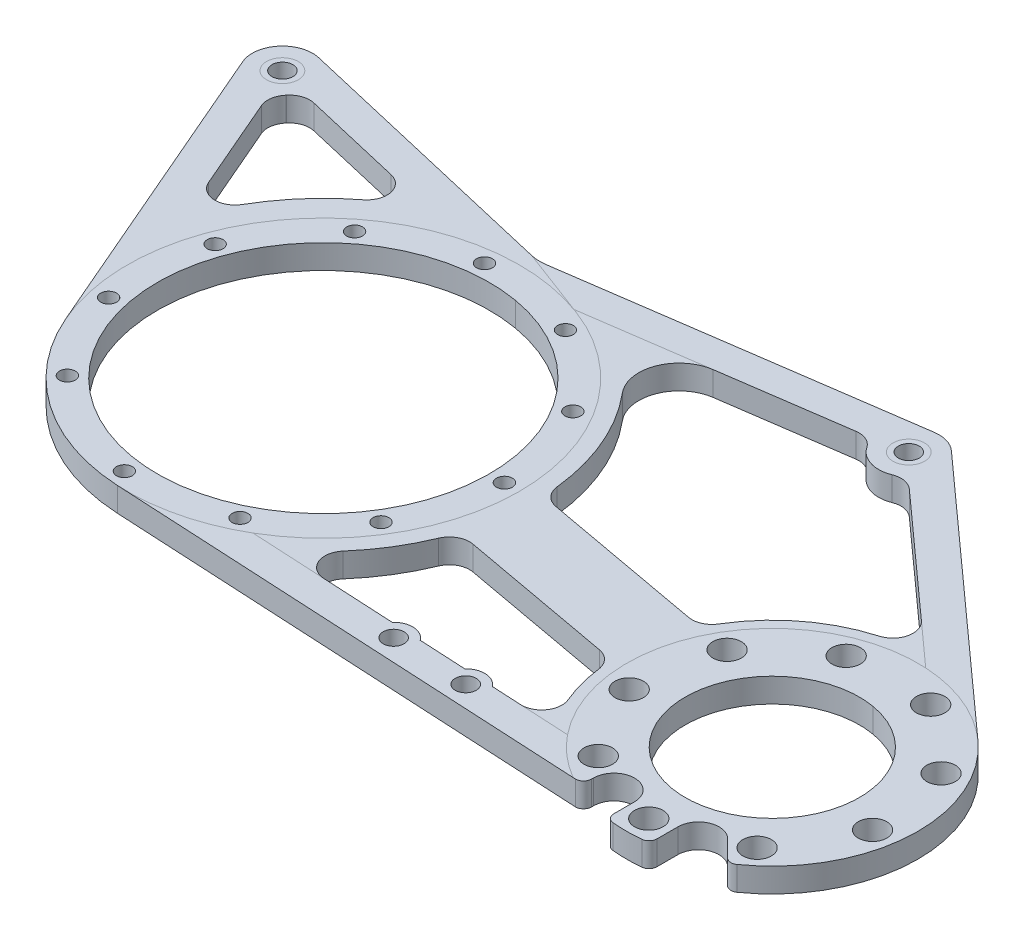
from build123d import *

# Parameters (mm, degrees)
SKETCH2_R             = 2.5
SKETCH2_R_2           = 4.5
SKETCH2_R_3           = 27.4955
SKETCH2_R_4           = 3.3
BOSS_EXTRUDE1_DEPTH   = 7.62
CUT_EXTRUDE1_DEPTH    = 977.654400972
FILLET2_R             = 12.7
CUT_EXTRUDE2_DEPTH    = 977.654400972
CIRPATTERN2_START     = 31.381947118
CIRPATTERN2_OUTLINE_R = 2.5
CIRPATTERN2_DEPTH     = 7.62
FILLET4_R             = 6.3754
CUT_EXTRUDE4_DEPTH    = 977.654400972
FILLET5_R             = 6.3754
FILLET6_R             = 6.3754
FILLET7_R             = 12.7
SKETCH11_R            = 3.3
CUT_EXTRUDE5_DEPTH    = 977.654400972
BOSS_EXTRUDE2_DEPTH   = 7.62


# Read off the part's stored shape, not the designer's step: CirPattern2
with BuildPart() as part:
    # Sketch2 → Boss-Extrude1 (new body)
    # profile 1 of 10: a face of its own
    with BuildSketch(Plane(origin=(0, 31.381947118, 0), x_dir=(1, 0, 0), z_dir=(0, 1, 0))):
        with BuildLine():
            ThreePointArc((-913.231203194, -139.306107665), (-891.842137326, -162.294673087), (-861.92593364, -171.83338557))
            ThreePointArc((-861.92593364, -171.83338557), (-820.11475592, -158.430942405), (-797.704649202, -120.673993615))
            ThreePointArc((-797.704649202, -120.673993615), (-797.01050218, -115.359784371), (-796.77854046, -110.005453999))
            ThreePointArc((-796.77854046, -110.005453999), (-871.210429691, -49.371943878), (-915.540423748, -134.526980787))
            ThreePointArc((-915.540423748, -134.526980787), (-914.437051565, -136.941301899), (-913.231203194, -139.306107665))
        make_face()
        with Locations((-864.664842136, -166.842380319)):
            Circle(SKETCH2_R, mode=Mode.SUBTRACT)
        with BuildLine():
            ThreePointArc((-806.30354046, -110.005453999), (-806.499815761, -114.536041237), (-807.087170934, -119.032679828))
            ThreePointArc((-807.087170934, -119.032679828), (-910.882265158, -105.474866761), (-806.30354046, -110.005453999))
        make_face(mode=Mode.SUBTRACT)
    # profile 2 of 10: a face of its own
    with BuildSketch(Plane(origin=(0, 31.381947118, 0), x_dir=(1, 0, 0), z_dir=(0, 1, 0))):
        with BuildLine():
            ThreePointArc((-663.719686073, -177.370678379), (-662.142049476, -178.105218992), (-660.461885462, -177.651858179))
            ThreePointArc((-660.461885462, -177.651858179), (-688.572459971, -94.109699917), (-710.607035859, -179.455901191))
            ThreePointArc((-710.607035859, -179.455901191), (-708.047835111, -179.48984757), (-706.758334948, -177.278999281))
            Line((-706.758334948, -177.278999281), (-706.758334948, -176.701988839))
            ThreePointArc((-706.758334948, -176.701988839), (-700.258334948, -170.201988839), (-693.758334948, -176.701988839))
            Line((-693.758334948, -176.701988839), (-693.758334948, -183.274721629))
            ThreePointArc((-693.758334948, -183.274721629), (-693.101169654, -184.979577479), (-691.469725918, -185.802250576))
            ThreePointArc((-691.469725918, -185.802250576), (-686.919549358, -186.027976628), (-682.369372798, -185.802250576))
            ThreePointArc((-682.369372798, -185.802250576), (-680.737929062, -184.979577479), (-680.080763768, -183.274721629))
            Line((-680.080763768, -183.274721629), (-680.080763768, -176.701988839))
            ThreePointArc((-680.080763768, -176.701988839), (-676.068206079, -170.696771877), (-668.984569691, -172.105794761))
            Line((-668.984569691, -172.105794761), (-663.719686073, -177.370678379))
        make_face()
        with Locations((-686.919549358, -179.053976628)):
            Circle(SKETCH2_R_2, mode=Mode.SUBTRACT)
        with Locations((-661.85083258, -169.92970991)):
            Circle(SKETCH2_R_2, mode=Mode.SUBTRACT)
        with Locations((-648.51204699, -146.826255557)):
            Circle(SKETCH2_R_2, mode=Mode.SUBTRACT)
        with Locations((-653.14455861, -120.553976628)):
            Circle(SKETCH2_R_2, mode=Mode.SUBTRACT)
        with Locations((-673.580763768, -103.405964417)):
            Circle(SKETCH2_R_2, mode=Mode.SUBTRACT)
        with Locations((-700.258334948, -103.405964417)):
            Circle(SKETCH2_R_2, mode=Mode.SUBTRACT)
        with Locations((-720.694540106, -120.553976628)):
            Circle(SKETCH2_R_2, mode=Mode.SUBTRACT)
        with Locations((-725.327051725, -146.826255557)):
            Circle(SKETCH2_R_2, mode=Mode.SUBTRACT)
        with Locations((-711.988266136, -169.92970991)):
            Circle(SKETCH2_R_2, mode=Mode.SUBTRACT)
        with Locations((-686.919549358, -140.053976628)):
            Circle(SKETCH2_R_3, mode=Mode.SUBTRACT)
    # profile 3 of 10: a face of its own
    with BuildSketch(Plane(origin=(0, 31.381947118, 0), x_dir=(1, 0, 0), z_dir=(0, 1, 0))):
        with BuildLine():
            Line((-861.92593364, -171.83338557), (-709.563399524, -179.805130863))
            ThreePointArc((-709.563399524, -179.805130863), (-710.104359013, -179.687717863), (-710.607035859, -179.455901191))
            ThreePointArc((-710.607035859, -179.455901191), (-728.743420505, -159.142519743), (-732.205854251, -132.131902082))
            Line((-732.205854251, -132.131902082), (-797.704649202, -120.673993615))
            ThreePointArc((-797.704649202, -120.673993615), (-820.11475592, -158.430942405), (-861.92593364, -171.83338557))
        make_face()
    # profile 4 of 10: a face of its own
    with BuildSketch(Plane(origin=(0, 31.381947118, 0), x_dir=(1, 0, 0), z_dir=(0, 1, 0))):
        with BuildLine():
            ThreePointArc((-796.77854046, -110.005453999), (-797.01050218, -115.359784371), (-797.704649202, -120.673993615))
            Line((-797.704649202, -120.673993615), (-732.205854251, -132.131902082))
            ThreePointArc((-732.205854251, -132.131902082), (-701.928176702, -96.598829853), (-656.175138478, -105.872258186))
            Line((-656.175138478, -105.872258186), (-734.471346389, -35.449503096))
            Line((-734.471346389, -35.449503096), (-737.45167366, -41.840835553))
            ThreePointArc((-737.45167366, -41.840835553), (-749.026894919, -46.874452701), (-755.434553976, -35.999483543))
            Line((-755.434553976, -35.999483543), (-753.896931719, -28.08212915))
            Line((-753.896931719, -28.08212915), (-944.165914661, -23.010008435))
            Line((-944.165914661, -23.010008435), (-941.416205936, -26.93699947))
            ThreePointArc((-941.416205936, -26.93699947), (-940.134475202, -29.536092286), (-939.693629158, -32.400315026))
            ThreePointArc((-939.693629158, -32.400315026), (-945.26796105, -41.067370264), (-955.466405327, -39.589954651))
            Line((-955.466405327, -39.589954651), (-957.104925163, -38.166085623))
            Line((-957.104925163, -38.166085623), (-915.540423748, -134.526980787))
            ThreePointArc((-915.540423748, -134.526980787), (-871.210429691, -49.371943878), (-796.77854046, -110.005453999))
        make_face()
    # profile 5 of 10: a face of its own
    with BuildSketch(Plane(origin=(0, 31.381947118, 0), x_dir=(1, 0, 0), z_dir=(0, 1, 0))):
        with BuildLine():
            ThreePointArc((-755.434553976, -35.999483543), (-749.026894919, -46.874452701), (-737.45167366, -41.840835553))
            ThreePointArc((-737.45167366, -41.840835553), (-736.785035864, -39.876983933), (-736.559255332, -37.81539661))
            ThreePointArc((-736.559255332, -37.81539661), (-737.383766778, -33.938913161), (-739.714556945, -30.733548866))
            ThreePointArc((-739.714556945, -30.733548866), (-742.67316861, -28.92213442), (-746.084255332, -28.29039661))
            ThreePointArc((-746.084255332, -28.29039661), (-752.143506648, -30.466172264), (-755.434553976, -35.999483543))
        make_face()
        with BuildLine():
            ThreePointArc((-742.844781786, -38.444531846), (-746.713390568, -41.054870156), (-749.323728878, -37.186261374))
            ThreePointArc((-749.323728878, -37.186261374), (-745.455120096, -34.575923064), (-742.844781786, -38.444531846))
        make_face(mode=Mode.SUBTRACT)
    # profile 6 of 10: a face of its own
    with BuildSketch(Plane(origin=(0, 31.381947118, 0), x_dir=(1, 0, 0), z_dir=(0, 1, 0))):
        with BuildLine():
            Line((-753.896931719, -28.08212915), (-755.434553976, -35.999483543))
            ThreePointArc((-755.434553976, -35.999483543), (-752.143506648, -30.466172264), (-746.084255332, -28.29039661))
            Line((-746.084255332, -28.29039661), (-753.896931719, -28.08212915))
        make_face()
    # profile 7 of 10: a face of its own
    with BuildSketch(Plane(origin=(0, 31.381947118, 0), x_dir=(1, 0, 0), z_dir=(0, 1, 0))):
        with BuildLine():
            Line((-737.45167366, -41.840835553), (-734.471346389, -35.449503096))
            Line((-734.471346389, -35.449503096), (-739.714556945, -30.733548866))
            ThreePointArc((-739.714556945, -30.733548866), (-737.383766778, -33.938913161), (-736.559255332, -37.81539661))
            ThreePointArc((-736.559255332, -37.81539661), (-736.785035864, -39.876983933), (-737.45167366, -41.840835553))
        make_face()
    # profile 8 of 10: a face of its own
    with BuildSketch(Plane(origin=(0, 31.381947118, 0), x_dir=(1, 0, 0), z_dir=(0, 1, 0))):
        with BuildLine():
            Line((-957.964688125, -36.172857609), (-957.104925163, -38.166085623))
            Line((-957.104925163, -38.166085623), (-955.466405327, -39.589954651))
            ThreePointArc((-955.466405327, -39.589954651), (-956.907771572, -38.021944143), (-957.964688125, -36.172857609))
        make_face()
    # profile 9 of 10: a face of its own
    with BuildSketch(Plane(origin=(0, 31.381947118, 0), x_dir=(1, 0, 0), z_dir=(0, 1, 0))):
        with BuildLine():
            ThreePointArc((-948.71116187, -22.888842903), (-944.596891068, -24.071739996), (-941.416205936, -26.93699947))
            Line((-941.416205936, -26.93699947), (-944.165914661, -23.010008435))
            Line((-944.165914661, -23.010008435), (-948.71116187, -22.888842903))
        make_face()
    # profile 10 of 10: a face of its own
    with BuildSketch(Plane(origin=(0, 31.381947118, 0), x_dir=(1, 0, 0), z_dir=(0, 1, 0))):
        with BuildLine():
            ThreePointArc((-957.964688125, -36.172857609), (-956.907771572, -38.021944143), (-955.466405327, -39.589954651))
            ThreePointArc((-955.466405327, -39.589954651), (-945.26796105, -41.067370264), (-939.693629158, -32.400315026))
            ThreePointArc((-939.693629158, -32.400315026), (-940.134475202, -29.536092286), (-941.416205936, -26.93699947))
            ThreePointArc((-941.416205936, -26.93699947), (-944.596891068, -24.071739996), (-948.71116187, -22.888842903))
            Line((-948.71116187, -22.888842903), (-949.218629158, -22.875315026))
            ThreePointArc((-949.218629158, -22.875315026), (-957.176615495, -27.166188695), (-957.964688125, -36.172857609))
        make_face()
        with Locations((-949.218629158, -32.400315026)):
            Circle(SKETCH2_R_4, mode=Mode.SUBTRACT)
    extrude(amount=BOSS_EXTRUDE1_DEPTH)

    # Sketch3 → Cut-Extrude1 (cut, through all)
    with BuildSketch(Plane.XZ.offset(-31.381947118)):
        Polygon((-753.896931719, 28.08212915), (-754.143531549, 29.351893709), (-856.972172798, 44.147094697), (-943.505934216, 23.952558192), (-944.165914661, 23.010008435), align=None)
        with BuildLine():
            Line((-948.71116187, 22.888842903), (-944.165914661, 23.010008435))
            Line((-944.165914661, 23.010008435), (-943.505934216, 23.952558192))
            Line((-943.505934216, 23.952558192), (-947.053929007, 23.124556391))
            ThreePointArc((-947.053929007, 23.124556391), (-947.877357404, 22.970224089), (-948.71116187, 22.888842903))
        make_face()
        with BuildLine():
            Line((-753.896931719, 28.08212915), (-746.084255332, 28.29039661))
            ThreePointArc((-746.084255332, 28.29039661), (-746.764244179, 28.314699785), (-747.440763024, 28.387485289))
            Line((-747.440763024, 28.387485289), (-754.143531549, 29.351893709))
            Line((-754.143531549, 29.351893709), (-753.896931719, 28.08212915))
        make_face()
    extrude(amount=-CUT_EXTRUDE1_DEPTH, mode=Mode.SUBTRACT)

    # Fillet2
    fillet2_edges = [part.edges().sort_by_distance(p)[0] for p in [
        (-856.972172798, 35.191947118, 44.147094697),
    ]]
    fillet(fillet2_edges, radius=FILLET2_R)

    # Sketch4 → Cut-Extrude2 (cut, through all)
    with BuildSketch(Plane.XZ.offset(-31.381947118)):
        with BuildLine():
            Line((-709.563399524, 179.805130863), (-709.298334948, 179.818999281))
            ThreePointArc((-709.298334948, 179.818999281), (-709.431048514, 179.815529807), (-709.563399524, 179.805130863))
        make_face()
        with BuildLine():
            Line((-924.603702119, 87.862970189), (-944.871408741, 40.875413825))
            ThreePointArc((-944.871408741, 40.875413825), (-941.911570095, 38.510348812), (-940.107819617, 35.178583284))
            Line((-940.107819617, 35.178583284), (-888.550368384, 47.2106366))
            ThreePointArc((-888.550368384, 47.2106366), (-910.712397168, 63.869275109), (-924.603702119, 87.862970189))
        make_face()
    extrude(amount=-CUT_EXTRUDE2_DEPTH, mode=Mode.SUBTRACT)

    # CirPattern2 outline → CirPattern2 (cut)
    with BuildSketch(Plane(origin=(0, 0, 0), x_dir=(1, 0, 0), z_dir=(0, 1, 0)).offset(CIRPATTERN2_START)):
        with Locations((-899.801310049, -149.705179871)):
            Circle(CIRPATTERN2_OUTLINE_R)
        with Locations((-914.592175842, -121.887607129)):
            Circle(CIRPATTERN2_OUTLINE_R)
        with Locations((-912.394473738, -90.459002808)):
            Circle(CIRPATTERN2_OUTLINE_R)
        with Locations((-893.876093775, -64.97063943)):
            Circle(CIRPATTERN2_OUTLINE_R)
        with Locations((-864.664842136, -53.168527679)):
            Circle(CIRPATTERN2_OUTLINE_R)
        with Locations((-833.638129421, -58.639374253)):
            Circle(CIRPATTERN2_OUTLINE_R)
        with Locations((-810.225091765, -79.720568048)):
            Circle(CIRPATTERN2_OUTLINE_R)
        with Locations((-801.54104046, -110.005453999)):
            Circle(CIRPATTERN2_OUTLINE_R)
        with Locations((-810.225091765, -140.29033995)):
            Circle(CIRPATTERN2_OUTLINE_R)
        with Locations((-833.638129421, -161.371533745)):
            Circle(CIRPATTERN2_OUTLINE_R)
    extrude(amount=CIRPATTERN2_DEPTH, mode=Mode.SUBTRACT)

    # Fillet4
    fillet4_edges = [part.edges().sort_by_distance(p)[0] for p in [
        (-940.107819617, 35.191947118, 35.178583284),
        (-944.871408741, 35.191947118, 40.875413825),
        (-924.603702119, 35.191947118, 87.862970189),
        (-888.550368384, 35.191947118, 47.2106366),
    ]]
    fillet(fillet4_edges, radius=FILLET4_R)

    # Sketch10 → Cut-Extrude4 (cut, through all)
    with BuildSketch(Plane.XZ.offset(-31.381947118)):
        with BuildLine():
            Line((-818.912925661, 163.909968089), (-726.837683008, 168.727427883))
            ThreePointArc((-726.837683008, 168.727427883), (-733.466620172, 155.833533011), (-736.045267956, 141.566581393))
            Line((-736.045267956, 141.566581393), (-795.006975171, 130.798118199))
            ThreePointArc((-795.006975171, 130.798118199), (-804.375257045, 149.220128909), (-818.912925661, 163.909968089))
        make_face()
        with BuildLine():
            Line((-791.745025376, 107.510234448), (-731.129548627, 118.580733611))
            ThreePointArc((-731.129548627, 118.580733611), (-713.453111449, 98.682557946), (-687.995575057, 90.916756828))
            Line((-687.995575057, 90.916756828), (-739.442809112, 44.643047532))
            ThreePointArc((-739.442809112, 44.643047532), (-748.851749471, 46.929484671), (-755.400758562, 39.797413906))
            Line((-755.400758562, 39.797413906), (-828.325614891, 50.289995479))
            ThreePointArc((-828.325614891, 50.289995479), (-802.247103164, 73.921149949), (-791.745025376, 107.510234448))
        make_face()
    extrude(amount=-CUT_EXTRUDE4_DEPTH, mode=Mode.SUBTRACT)

    # Fillet5
    fillet5_edges = [part.edges().sort_by_distance(p)[0] for p in [
        (-795.006975171, 35.191947118, 130.798118199),
        (-818.912925661, 35.191947118, 163.909968089),
        (-726.837683008, 35.191947118, 168.727427883),
        (-736.045267956, 35.191947118, 141.566581393),
        (-739.442809112, 35.191947118, 44.643047532),
        (-755.400758562, 35.191947118, 39.797413906),
        (-731.129548627, 35.191947118, 118.580733611),
        (-687.995575057, 35.191947118, 90.916756828),
    ]]
    fillet(fillet5_edges, radius=FILLET5_R)

    # Fillet6
    fillet6_edges = [part.edges().sort_by_distance(p)[0] for p in [
        (-791.745025376, 35.191947118, 107.510234448),
    ]]
    fillet(fillet6_edges, radius=FILLET6_R)

    # Fillet7
    fillet7_edges = [part.edges().sort_by_distance(p)[0] for p in [
        (-828.325614891, 35.191947118, 50.289995479),
    ]]
    fillet(fillet7_edges, radius=FILLET7_R)

    # Sketch11 → Cut-Extrude5 (cut, through all)
    with BuildSketch(Plane.XZ.offset(-31.381947118)):
        with Locations((-776.621002864, 169.882858371)):
            Circle(SKETCH11_R)
        with Locations((-752.529032998, 171.230019818)):
            Circle(SKETCH11_R)
    extrude(amount=-CUT_EXTRUDE5_DEPTH, mode=Mode.SUBTRACT)

    # Sketch12 → Boss-Extrude2 (add)
    with BuildSketch(Plane.XZ.offset(-31.381947118)):
        with BuildLine():
            Line((-756.930992456, 167.152918773), (-747.725637773, 167.634551238))
            ThreePointArc((-747.725637773, 167.634551238), (-752.215536385, 165.238215426), (-756.930992456, 167.152918773))
        make_face()
        with BuildLine():
            Line((-781.098152698, 165.888471138), (-771.751459497, 166.377498562))
            ThreePointArc((-771.751459497, 166.377498562), (-776.307506251, 163.891053979), (-781.098152698, 165.888471138))
        make_face()
    extrude(amount=-BOSS_EXTRUDE2_DEPTH)


solid = part.part
